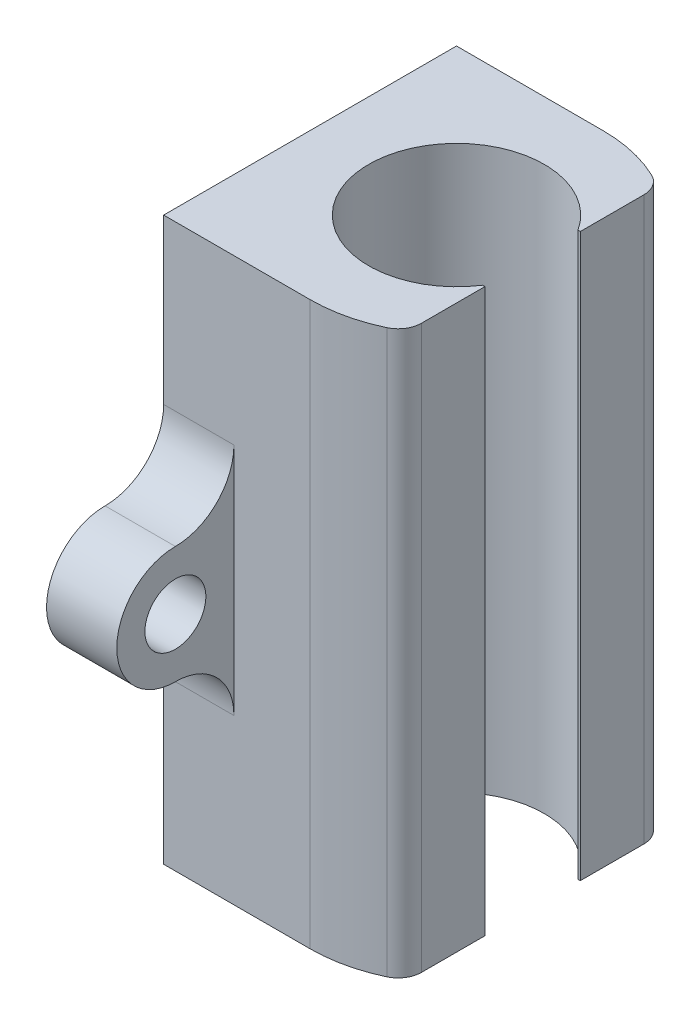
from build123d import *

# Parameters (mm, degrees)
SKETCH1_R           = 7.5
BOSS_EXTRUDE1_DEPTH = 48
BOSS_EXTRUDE2_DEPTH = 6
SKETCH3_R           = 2.6
CUT_EXTRUDE1_DEPTH  = 6
FILLET6_R           = 5
FILLET7_R           = 5
CUT_EXTRUDE4_DEPTH  = 55.465585465
FILLET9_R           = 2
FILLET11_R          = 2


with BuildPart() as part:
    # Sketch1 → Boss-Extrude1 (new body)
    with BuildSketch(Plane(origin=(0, 0, 0), x_dir=(1, 0, 0), z_dir=(0, 1, 0))):
        with BuildLine():
            Line((0, 12.5), (-12.5, 12.5))
            Line((-12.5, 12.5), (-12.5, -12.5))
            Line((-12.5, -12.5), (0, -12.5))
            ThreePointArc((0, -12.5), (12.5, 0), (0, 12.5))
        make_face()
        with Locations(Location((0, 0, 0), (0, 0, 270))):
            Circle(SKETCH1_R, mode=Mode.SUBTRACT)
    extrude(amount=BOSS_EXTRUDE1_DEPTH)

    # Sketch2 → Boss-Extrude2 (add)
    with BuildSketch(Plane.ZY.offset(12.5)):
        with BuildLine():
            Line((-17.5, 29), (-12.5, 29))
            Line((-12.5, 29), (-12.5, 19))
            Line((-12.5, 19), (-17.5, 19))
            ThreePointArc((-17.5, 19), (-22.5, 24), (-17.5, 29))
        make_face()
        with BuildLine():
            Line((17.5, 29), (12.5, 29))
            Line((12.5, 29), (12.5, 19))
            Line((12.5, 19), (17.5, 19))
            ThreePointArc((17.5, 19), (22.5, 24), (17.5, 29))
        make_face()
    extrude(amount=-BOSS_EXTRUDE2_DEPTH)

    # Sketch3 → Cut-Extrude1 (cut)
    with BuildSketch(Plane.ZY.offset(12.5)):
        with Locations((-17.5, 24)):
            Circle(SKETCH3_R)
        with Locations((17.5, 24)):
            Circle(SKETCH3_R)
    extrude(amount=-CUT_EXTRUDE1_DEPTH, mode=Mode.SUBTRACT)

    # Fillet6
    fillet6_edges = [part.edges().sort_by_distance(p)[0] for p in [
        (-9.5, 19, -12.5),
    ]]
    fillet(fillet6_edges, radius=FILLET6_R - 0.0001)  # a hair under: the kernel refuses the full size

    # Fillet7
    fillet7_edges = [part.edges().sort_by_distance(p)[0] for p in [
        (-9.5, 19, 12.5),
        (-9.5, 29, 12.5),
        (-9.5, 29, -12.5),
    ]]
    fillet(fillet7_edges, radius=FILLET7_R - 0.0001)  # a hair under: the kernel refuses the full size

    # Sketch5 → Cut-Extrude4 (cut, through all)
    with BuildSketch(Plane.XZ):
        Polygon((12.5, 12.5), (6.5, 12.5), (6.5, 4.06939799), (6.3, 4.06939799), (6.3, -4.06939799), (6.5, -4.06939799), (6.5, -12.5), (12.5, -12.5), align=None)
    extrude(amount=-CUT_EXTRUDE4_DEPTH, mode=Mode.SUBTRACT)

    # Fillet9
    fillet9_edges = [part.edges().sort_by_distance(p)[0] for p in [
        (6.5, 24, 10.677078252),
    ]]
    fillet(fillet9_edges, radius=FILLET9_R)

    # Fillet11
    fillet11_edges = [part.edges().sort_by_distance(p)[0] for p in [
        (6.5, 24, -10.677078252),
    ]]
    fillet(fillet11_edges, radius=FILLET11_R)


solid = part.part
